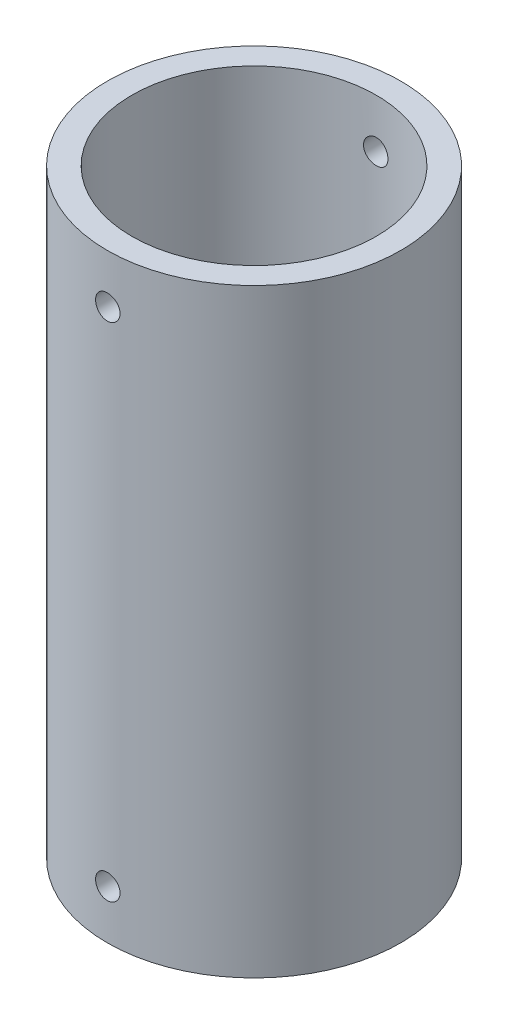
from build123d import *

# Parameters (mm, degrees)
SKETCH1_R               = 38.1
SKETCH1_R_2             = 31.75
BOSS_EXTRUDE1_DEPTH     = 155.702
CUT_EXTRUDE1_DEPTH      = 165.761442103
CUT_EXTRUDE1_DEPTH_BACK = 165.761442103
SKETCH2_R               = 3.175


with BuildPart() as part:
    # Sketch1 → Boss-Extrude1 (new body)
    with BuildSketch(Plane(origin=(0, 0, 0), x_dir=(1, 0, 0), z_dir=(0, 1, 0))):
        Circle(SKETCH1_R)
        Circle(SKETCH1_R_2, mode=Mode.SUBTRACT)
    extrude(amount=BOSS_EXTRUDE1_DEPTH)

    # Sketch2 → Cut-Extrude1 (cut, two sides: drawn at the far end of the back side and taken through both)
    with BuildSketch(Plane.XY.offset(-CUT_EXTRUDE1_DEPTH_BACK)):
        with Locations((0, 143.002)):
            Circle(SKETCH2_R)
        with Locations((0, 12.7)):
            Circle(SKETCH2_R)
    extrude(amount=CUT_EXTRUDE1_DEPTH + CUT_EXTRUDE1_DEPTH_BACK, mode=Mode.SUBTRACT)


solid = part.part
